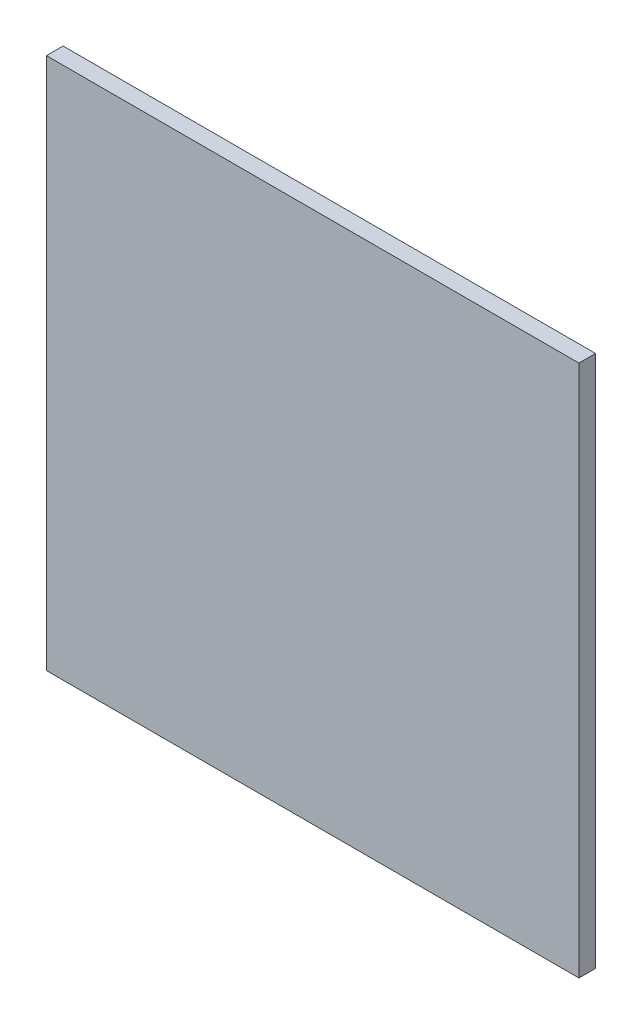
from build123d import *

# Parameters (mm, degrees)
LED_PANEL_W             = 80
LED_PANEL_H             = 80
EXTRUDE_LED_PANEL_DEPTH = 2.5


with BuildPart() as part:
    # LED panel → Extrude LED panel (new body)
    with BuildSketch(Plane.XY):
        Rectangle(LED_PANEL_W, LED_PANEL_H)
    extrude(amount=EXTRUDE_LED_PANEL_DEPTH)


solid = part.part
